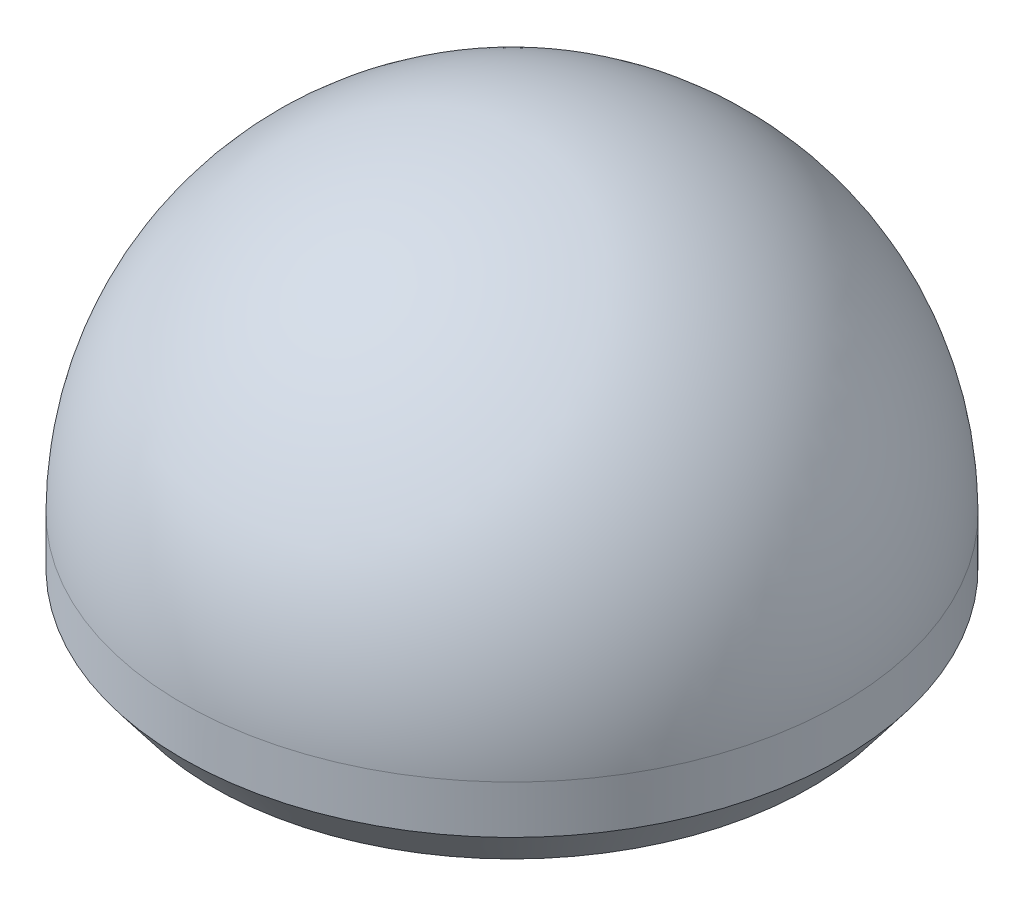
from build123d import *

# Parameters (mm, degrees)
CIRPATTERN2_COUNT = 4


with BuildPart() as part:
    # Sketch1 → Revolve1 (revolve)
    with BuildSketch(Plane.XY):
        with BuildLine():
            Line((-150, 0), (-150, -21.839688718))
            Line((-150, -21.839688718), (-135.992561225, -40.2238734))
            ThreePointArc((-135.992561225, -40.2238734), (-70.908280017, -10.266781974), (0, 0))
            Line((0, 0), (0, 150))
            ThreePointArc((0, 150), (-106.066017178, 106.066017178), (-150, 0))
        make_face()
    revolve(axis=Axis((0, 0, 0), (0, 1, 0)))

    # Sketch2 → Cut-Revolve2 (revolve, cut)
    with BuildSketch(Plane.XY):
        with BuildLine():
            Line((88.925237265, -25.679918596), (88.925237265, 14.320081404))
            ThreePointArc((88.925237265, 14.320081404), (108.925237265, -5.679918596), (88.925237265, -25.679918596))
        make_face()
    cut_revolve2 = revolve(axis=Axis((88.925237265, -25.679918596, 0), (0, 1, 0)), mode=Mode.SUBTRACT)

    # CirPattern2: Cut-Revolve2 ×4 about axis
    cirpattern2_axis = Axis((0, -45.019187469, 0), (0, 1, 0))
    for i in range(1, CIRPATTERN2_COUNT):
        add(cut_revolve2.rotate(cirpattern2_axis, i * 360 / CIRPATTERN2_COUNT), mode=Mode.SUBTRACT)


solid = part.part
